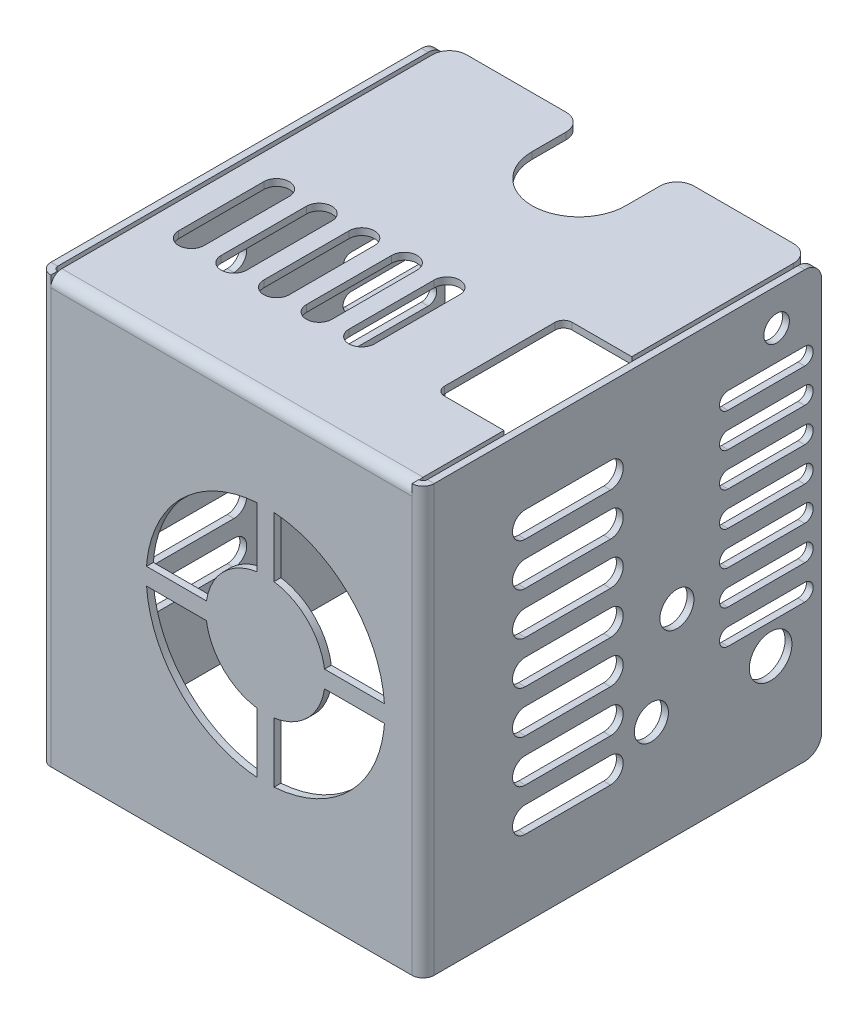
from build123d import *

# Parameters (mm, degrees)
SKETCH_1_W                       = 45
SKETCH_1_H                       = 50
SM_BASE_FLANGE_1_DEPTH           = 0.8
SM_EDGE_FLANGE_3_STRIP_W         = 4.2
SM_EDGE_FLANGE_3_STRIP_H         = 0.8
SM_EDGE_FLANGE_3_STRIP_CUT_DEPTH = 50
SM_EDGE_FLANGE_3_DEPTH           = 50
SM_EDGE_FLANGE_3_PROFILE_R       = 1.5
SM_EDGE_FLANGE_3_FLAT_DEPTH      = 0.8
SM_EDGE_FLANGE_5_STRIP_W         = 4.2
SM_EDGE_FLANGE_5_STRIP_H         = 0.8
SM_EDGE_FLANGE_5_STRIP_CUT_DEPTH = 50
SM_EDGE_FLANGE_5_DEPTH           = 50
SM_EDGE_FLANGE_5_PROFILE_R       = 2.5
SM_EDGE_FLANGE_5_PROFILE_R_2     = 1.5
SM_EDGE_FLANGE_5_FLAT_DEPTH      = 0.8
SM_EDGE_FLANGE_1_STRIP_W         = 4.2
SM_EDGE_FLANGE_1_STRIP_H         = 0.8
SM_EDGE_FLANGE_1_STRIP_CUT_DEPTH = 42.4
SM_EDGE_FLANGE_1_DEPTH           = 42.4
SM_EDGE_FLANGE_1_FLAT_DEPTH      = 0.8
SKETCH_30_R                      = 2.1
EXTRUDE_3_DEPTH                  = 8.2
HOLE_WIZARD_M2_1_D               = 1.6
HOLE_WIZARD_M2_1_DEPTH           = 6
HOLE_WIZARD_M2_1_TIP             = 0.480688495
CUT_EXTRUDE_2_REACH              = 71.572
MACRO_START                      = -0.8
MACRO_FEATURE_1_DEPTH            = 0.8
CUT_EXTRUDE_3_REACH              = 74.087
SKETCH_35_W                      = 8
SKETCH_35_H                      = 15
FILLET_1_R                       = 1
CUT_EXTRUDE_4_REACH              = 74.087
CUT_EXTRUDE_5_REACH              = 71.572
SKETCH_37_R                      = 1.5
CUT_EXTRUDE_6_REACH              = 71.572
SKETCH_38_R                      = 2


# Read off the part's stored shape, not the designer's step: 通风口1
# Sheet-metal steps are written as plain solids
with BuildPart() as part:
    # Sketch 1 → 基体-法兰1 (new body)
    with BuildSketch(Plane.XY):
        Rectangle(SKETCH_1_W, SKETCH_1_H)
    extrude(amount=-SM_BASE_FLANGE_1_DEPTH)

    # 边线-法兰3 strip (across the edge) → 边线-法兰3 strip cut (cut)
    with BuildSketch(Plane(origin=(-22.5, -25, -0.8), x_dir=(1, 0, 0), z_dir=(0, 1, 0))):
        with Locations((-0.8, -0.4)):
            Rectangle(SM_EDGE_FLANGE_3_STRIP_W, SM_EDGE_FLANGE_3_STRIP_H)
    extrude(amount=SM_EDGE_FLANGE_3_STRIP_CUT_DEPTH, mode=Mode.SUBTRACT)

    # 边线-法兰3 bend section (across the edge) → 边线-法兰3 (add)
    with BuildSketch(Plane(origin=(-22.5, -25, -0.8), x_dir=(1, 0, 0), z_dir=(0, 1, 0))):
        with BuildLine():
            Line((0, 0.5), (0.8, 0.5))
            ThreePointArc((0.8, 0.5), (0.946446609, 0.146446609), (1.3, 0))
            Line((1.3, 0), (1.3, -0.8))
            ThreePointArc((1.3, -0.8), (0.380761184, -0.419238816), (0, 0.5))
        make_face()
    extrude(amount=SM_EDGE_FLANGE_3_DEPTH)

    # 边线-法兰3 profile (on flange) → 边线-法兰3 flat (add)
    with BuildSketch(Plane(origin=(-22.5, 0, -0.8), x_dir=(0, -1, 0), z_dir=(1, 0, 0))):
        with BuildLine():
            Line((-25, 0.5), (25, 0.5))
            Line((25, 0.5), (25, 44))
            ThreePointArc((25, 44), (24.414213562, 45.414213562), (23, 46))
            Line((23, 46), (-23, 46))
            ThreePointArc((-23, 46), (-24.414213562, 45.414213562), (-25, 44))
            Line((-25, 44), (-25, 0.5))
        make_face()
        with Locations((12.3, 40.7)):
            Circle(SM_EDGE_FLANGE_3_PROFILE_R, mode=Mode.SUBTRACT)
        with Locations((-20.7, 40.7)):
            Circle(SM_EDGE_FLANGE_3_PROFILE_R, mode=Mode.SUBTRACT)
    extrude(amount=SM_EDGE_FLANGE_3_FLAT_DEPTH)

    # 边线-法兰5 strip (across the edge) → 边线-法兰5 strip cut (cut)
    with BuildSketch(Plane(origin=(22.5, 25, -0.8), x_dir=(-1, 0, 0), z_dir=(0, -1, 0))):
        with Locations((-0.8, -0.4)):
            Rectangle(SM_EDGE_FLANGE_5_STRIP_W, SM_EDGE_FLANGE_5_STRIP_H)
    extrude(amount=SM_EDGE_FLANGE_5_STRIP_CUT_DEPTH, mode=Mode.SUBTRACT)

    # 边线-法兰5 bend section (across the edge) → 边线-法兰5 (add)
    with BuildSketch(Plane(origin=(22.5, 25, -0.8), x_dir=(-1, 0, 0), z_dir=(0, -1, 0))):
        with BuildLine():
            Line((0, 0.5), (0.8, 0.5))
            ThreePointArc((0.8, 0.5), (0.946446609, 0.146446609), (1.3, 0))
            Line((1.3, 0), (1.3, -0.8))
            ThreePointArc((1.3, -0.8), (0.380761184, -0.419238816), (0, 0.5))
        make_face()
    extrude(amount=SM_EDGE_FLANGE_5_DEPTH)

    # 边线-法兰5 profile (on flange) → 边线-法兰5 flat (add)
    with BuildSketch(Plane(origin=(22.5, 0, -0.8), x_dir=(0, -1, 0), z_dir=(1, 0, 0))):
        with BuildLine():
            Line((25, 0.5), (25, 44))
            ThreePointArc((25, 44), (24.414213562, 45.414213562), (23, 46))
            Line((23, 46), (-23, 46))
            ThreePointArc((-23, 46), (-24.414213562, 45.414213562), (-25, 44))
            Line((-25, 44), (-25, 0.5))
            Line((-25, 0.5), (25, 0.5))
        make_face()
        with Locations((12.3, 40)):
            Circle(SM_EDGE_FLANGE_5_PROFILE_R, mode=Mode.SUBTRACT)
        with Locations((-20.7, 40.7)):
            Circle(SM_EDGE_FLANGE_5_PROFILE_R_2, mode=Mode.SUBTRACT)
    extrude(amount=-SM_EDGE_FLANGE_5_FLAT_DEPTH)

    # 边线-法兰1 strip (across the edge) → 边线-法兰1 strip cut (cut)
    with BuildSketch(Plane(origin=(-21.2, 25, -0.8), x_dir=(0, -1, 0), z_dir=(1, 0, 0))):
        with Locations((-0.8, -0.4)):
            Rectangle(SM_EDGE_FLANGE_1_STRIP_W, SM_EDGE_FLANGE_1_STRIP_H)
    extrude(amount=SM_EDGE_FLANGE_1_STRIP_CUT_DEPTH, mode=Mode.SUBTRACT)

    # 边线-法兰1 bend section (across the edge) → 边线-法兰1 (add)
    with BuildSketch(Plane(origin=(-21.2, 25, -0.8), x_dir=(0, -1, 0), z_dir=(1, 0, 0))):
        with BuildLine():
            Line((0, 0.5), (0.8, 0.5))
            ThreePointArc((0.8, 0.5), (0.946446609, 0.146446609), (1.3, 0))
            Line((1.3, 0), (1.3, -0.8))
            ThreePointArc((1.3, -0.8), (0.380761184, -0.419238816), (0, 0.5))
        make_face()
    extrude(amount=SM_EDGE_FLANGE_1_DEPTH)

    # 边线-法兰1 profile (on flange) → 边线-法兰1 flat (add)
    with BuildSketch(Plane(origin=(0, 25, -0.8), x_dir=(1, 0, 0), z_dir=(0, 1, 0))):
        with BuildLine():
            ThreePointArc((21.2, 44), (20.614213562, 45.414213562), (19.2, 46))
            Line((19.2, 46), (7.5, 46))
            ThreePointArc((7.5, 46), (6.085786438, 45.414213562), (5.5, 44))
            Line((5.5, 44), (5.5, 40))
            ThreePointArc((5.5, 40), (0, 34.5), (-5.5, 40))
            Line((-5.5, 40), (-5.5, 44))
            ThreePointArc((-5.5, 44), (-6.085786438, 45.414213562), (-7.5, 46))
            Line((-7.5, 46), (-19.2, 46))
            ThreePointArc((-19.2, 46), (-20.614213562, 45.414213562), (-21.2, 44))
            Line((-21.2, 44), (-21.2, 0.5))
            Line((-21.2, 0.5), (21.2, 0.5))
            Line((21.2, 0.5), (21.2, 44))
        make_face()
    extrude(amount=-SM_EDGE_FLANGE_1_FLAT_DEPTH)

    # 草图30 → 凸台-拉伸3 (add)
    with BuildSketch(Plane(origin=(0, 0, -0.8), x_dir=(-1, 0, 0), z_dir=(0, 0, -1))):
        with Locations(Location((-17.5, 17.5, 0), (0, 0, 180))):
            Circle(SKETCH_30_R)
        with Locations(Location((17.5, 17.5, 0), (0, 0, 180))):
            Circle(SKETCH_30_R)
        with Locations(Location((17.5, -17.5, 0), (0, 0, 180))):
            Circle(SKETCH_30_R)
        with Locations(Location((-17.5, -17.5, 0), (0, 0, 180))):
            Circle(SKETCH_30_R)
    extrude(amount=EXTRUDE_3_DEPTH)

    # M2 螺纹孔1
    with Locations(Plane(origin=(0, 0, -9), x_dir=(-1, 0, 0), z_dir=(0, 0, -1))):
        with Locations((-17.5, 17.5), (-17.5, -17.5), (17.5, -17.5), (17.5, 17.5)):
            Hole(HOLE_WIZARD_M2_1_D / 2, depth=HOLE_WIZARD_M2_1_DEPTH)
            with Locations((0, 0, -(HOLE_WIZARD_M2_1_DEPTH + HOLE_WIZARD_M2_1_TIP / 2))):  # 118° drill point
                Cone(0, HOLE_WIZARD_M2_1_D / 2, HOLE_WIZARD_M2_1_TIP, mode=Mode.SUBTRACT)

    # 草图33 → 切除-拉伸2 (cut, up to next)
    with BuildSketch(Plane.ZY.offset(22.5), mode=Mode.PRIVATE) as cut_extrude_2_sk1:
        with BuildLine():
            Line((-22, 17), (-12, 17))
            ThreePointArc((-12, 17), (-10.5, 15.5), (-12, 14))
            Line((-12, 14), (-22, 14))
            ThreePointArc((-22, 14), (-23.5, 15.5), (-22, 17))
        make_face()
    cut_extrude_2_tool1 = extrude(cut_extrude_2_sk1.sketch, amount=-CUT_EXTRUDE_2_REACH, mode=Mode.PRIVATE) & part.part
    # 草图33 → 切除-拉伸2 (cut, up to next)
    with BuildSketch(Plane.ZY.offset(22.5), mode=Mode.PRIVATE) as cut_extrude_2_sk2:
        with BuildLine():
            Line((-22, 12), (-12, 12))
            ThreePointArc((-12, 12), (-10.5, 10.5), (-12, 9))
            Line((-12, 9), (-22, 9))
            ThreePointArc((-22, 9), (-23.5, 10.5), (-22, 12))
        make_face()
    cut_extrude_2_tool2 = extrude(cut_extrude_2_sk2.sketch, amount=-CUT_EXTRUDE_2_REACH, mode=Mode.PRIVATE) & part.part
    # 草图33 → 切除-拉伸2 (cut, up to next)
    with BuildSketch(Plane.ZY.offset(22.5), mode=Mode.PRIVATE) as cut_extrude_2_sk3:
        with BuildLine():
            Line((-22, 7), (-12, 7))
            ThreePointArc((-12, 7), (-10.5, 5.5), (-12, 4))
            Line((-12, 4), (-22, 4))
            ThreePointArc((-22, 4), (-23.5, 5.5), (-22, 7))
        make_face()
    cut_extrude_2_tool3 = extrude(cut_extrude_2_sk3.sketch, amount=-CUT_EXTRUDE_2_REACH, mode=Mode.PRIVATE) & part.part
    # 草图33 → 切除-拉伸2 (cut, up to next)
    with BuildSketch(Plane.ZY.offset(22.5), mode=Mode.PRIVATE) as cut_extrude_2_sk4:
        with BuildLine():
            Line((-22, 2), (-12, 2))
            ThreePointArc((-12, 2), (-10.5, 0.5), (-12, -1))
            Line((-12, -1), (-22, -1))
            ThreePointArc((-22, -1), (-23.5, 0.5), (-22, 2))
        make_face()
    cut_extrude_2_tool4 = extrude(cut_extrude_2_sk4.sketch, amount=-CUT_EXTRUDE_2_REACH, mode=Mode.PRIVATE) & part.part
    # 草图33 → 切除-拉伸2 (cut, up to next)
    with BuildSketch(Plane.ZY.offset(22.5), mode=Mode.PRIVATE) as cut_extrude_2_sk5:
        with BuildLine():
            Line((-22, -3), (-12, -3))
            ThreePointArc((-12, -3), (-10.5, -4.5), (-12, -6))
            Line((-12, -6), (-22, -6))
            ThreePointArc((-22, -6), (-23.5, -4.5), (-22, -3))
        make_face()
    cut_extrude_2_tool5 = extrude(cut_extrude_2_sk5.sketch, amount=-CUT_EXTRUDE_2_REACH, mode=Mode.PRIVATE) & part.part
    # 草图33 → 切除-拉伸2 (cut, up to next)
    with BuildSketch(Plane.ZY.offset(22.5), mode=Mode.PRIVATE) as cut_extrude_2_sk6:
        with BuildLine():
            Line((-22, -8), (-12, -8))
            ThreePointArc((-12, -8), (-10.5, -9.5), (-12, -11))
            Line((-12, -11), (-22, -11))
            ThreePointArc((-22, -11), (-23.5, -9.5), (-22, -8))
        make_face()
    cut_extrude_2_tool6 = extrude(cut_extrude_2_sk6.sketch, amount=-CUT_EXTRUDE_2_REACH, mode=Mode.PRIVATE) & part.part
    # 草图33 → 切除-拉伸2 (cut, up to next)
    with BuildSketch(Plane.ZY.offset(22.5), mode=Mode.PRIVATE) as cut_extrude_2_sk7:
        with BuildLine():
            Line((-22, -13), (-12, -13))
            ThreePointArc((-12, -13), (-10.5, -14.5), (-12, -16))
            Line((-12, -16), (-22, -16))
            ThreePointArc((-22, -16), (-23.5, -14.5), (-22, -13))
        make_face()
    cut_extrude_2_tool7 = extrude(cut_extrude_2_sk7.sketch, amount=-CUT_EXTRUDE_2_REACH, mode=Mode.PRIVATE) & part.part
    # 草图33 → 切除-拉伸2 (cut, up to next)
    with BuildSketch(Plane.ZY.offset(22.5), mode=Mode.PRIVATE) as cut_extrude_2_sk8:
        with BuildLine():
            Line((-44.8, 17.2), (-35.8, 17.2))
            ThreePointArc((-35.8, 17.2), (-34.8, 16.2), (-35.8, 15.2))
            Line((-35.8, 15.2), (-44.8, 15.2))
            ThreePointArc((-44.8, 15.2), (-45.8, 16.2), (-44.8, 17.2))
        make_face()
    cut_extrude_2_tool8 = extrude(cut_extrude_2_sk8.sketch, amount=-CUT_EXTRUDE_2_REACH, mode=Mode.PRIVATE) & part.part
    # 草图33 → 切除-拉伸2 (cut, up to next)
    with BuildSketch(Plane.ZY.offset(22.5), mode=Mode.PRIVATE) as cut_extrude_2_sk9:
        with BuildLine():
            Line((-44.8, 13.2), (-35.8, 13.2))
            ThreePointArc((-35.8, 13.2), (-34.8, 12.2), (-35.8, 11.2))
            Line((-35.8, 11.2), (-44.8, 11.2))
            ThreePointArc((-44.8, 11.2), (-45.8, 12.2), (-44.8, 13.2))
        make_face()
    cut_extrude_2_tool9 = extrude(cut_extrude_2_sk9.sketch, amount=-CUT_EXTRUDE_2_REACH, mode=Mode.PRIVATE) & part.part
    # 草图33 → 切除-拉伸2 (cut, up to next)
    with BuildSketch(Plane.ZY.offset(22.5), mode=Mode.PRIVATE) as cut_extrude_2_sk10:
        with BuildLine():
            Line((-44.8, 9.2), (-35.8, 9.2))
            ThreePointArc((-35.8, 9.2), (-34.8, 8.2), (-35.8, 7.2))
            Line((-35.8, 7.2), (-44.8, 7.2))
            ThreePointArc((-44.8, 7.2), (-45.8, 8.2), (-44.8, 9.2))
        make_face()
    cut_extrude_2_tool10 = extrude(cut_extrude_2_sk10.sketch, amount=-CUT_EXTRUDE_2_REACH, mode=Mode.PRIVATE) & part.part
    # 草图33 → 切除-拉伸2 (cut, up to next)
    with BuildSketch(Plane.ZY.offset(22.5), mode=Mode.PRIVATE) as cut_extrude_2_sk11:
        with BuildLine():
            Line((-44.8, 5.2), (-35.8, 5.2))
            ThreePointArc((-35.8, 5.2), (-34.8, 4.2), (-35.8, 3.2))
            Line((-35.8, 3.2), (-44.8, 3.2))
            ThreePointArc((-44.8, 3.2), (-45.8, 4.2), (-44.8, 5.2))
        make_face()
    cut_extrude_2_tool11 = extrude(cut_extrude_2_sk11.sketch, amount=-CUT_EXTRUDE_2_REACH, mode=Mode.PRIVATE) & part.part
    # 草图33 → 切除-拉伸2 (cut, up to next)
    with BuildSketch(Plane.ZY.offset(22.5), mode=Mode.PRIVATE) as cut_extrude_2_sk12:
        with BuildLine():
            Line((-44.8, 1.2), (-35.8, 1.2))
            ThreePointArc((-35.8, 1.2), (-34.8, 0.2), (-35.8, -0.8))
            Line((-35.8, -0.8), (-44.8, -0.8))
            ThreePointArc((-44.8, -0.8), (-45.8, 0.2), (-44.8, 1.2))
        make_face()
    cut_extrude_2_tool12 = extrude(cut_extrude_2_sk12.sketch, amount=-CUT_EXTRUDE_2_REACH, mode=Mode.PRIVATE) & part.part
    # 草图33 → 切除-拉伸2 (cut, up to next)
    with BuildSketch(Plane.ZY.offset(22.5), mode=Mode.PRIVATE) as cut_extrude_2_sk13:
        with BuildLine():
            Line((-44.8, -2.8), (-35.8, -2.8))
            ThreePointArc((-35.8, -2.8), (-34.8, -3.8), (-35.8, -4.8))
            Line((-35.8, -4.8), (-44.8, -4.8))
            ThreePointArc((-44.8, -4.8), (-45.8, -3.8), (-44.8, -2.8))
        make_face()
    cut_extrude_2_tool13 = extrude(cut_extrude_2_sk13.sketch, amount=-CUT_EXTRUDE_2_REACH, mode=Mode.PRIVATE) & part.part
    # 草图33 → 切除-拉伸2 (cut, up to next)
    with BuildSketch(Plane.ZY.offset(22.5), mode=Mode.PRIVATE) as cut_extrude_2_sk14:
        with BuildLine():
            Line((-44.8, -6.8), (-35.8, -6.8))
            ThreePointArc((-35.8, -6.8), (-34.8, -7.8), (-35.8, -8.8))
            Line((-35.8, -8.8), (-44.8, -8.8))
            ThreePointArc((-44.8, -8.8), (-45.8, -7.8), (-44.8, -6.8))
        make_face()
    cut_extrude_2_tool14 = extrude(cut_extrude_2_sk14.sketch, amount=-CUT_EXTRUDE_2_REACH, mode=Mode.PRIVATE) & part.part
    cut_extrude_2_1 = cut_extrude_2_tool1.solids().sort_by_distance((-22.5, 15.5, -17))[0]
    add(cut_extrude_2_1, mode=Mode.SUBTRACT)
    cut_extrude_2_2 = cut_extrude_2_tool2.solids().sort_by_distance((-22.5, 10.5, -17))[0]
    add(cut_extrude_2_2, mode=Mode.SUBTRACT)
    cut_extrude_2_3 = cut_extrude_2_tool3.solids().sort_by_distance((-22.5, 5.5, -17))[0]
    add(cut_extrude_2_3, mode=Mode.SUBTRACT)
    cut_extrude_2_4 = cut_extrude_2_tool4.solids().sort_by_distance((-22.5, 0.5, -17))[0]
    add(cut_extrude_2_4, mode=Mode.SUBTRACT)
    cut_extrude_2_5 = cut_extrude_2_tool5.solids().sort_by_distance((-22.5, -4.5, -17))[0]
    add(cut_extrude_2_5, mode=Mode.SUBTRACT)
    cut_extrude_2_6 = cut_extrude_2_tool6.solids().sort_by_distance((-22.5, -9.5, -17))[0]
    add(cut_extrude_2_6, mode=Mode.SUBTRACT)
    cut_extrude_2_7 = cut_extrude_2_tool7.solids().sort_by_distance((-22.5, -14.5, -17))[0]
    add(cut_extrude_2_7, mode=Mode.SUBTRACT)
    cut_extrude_2_8 = cut_extrude_2_tool8.solids().sort_by_distance((-22.5, 16.2, -40.3))[0]
    add(cut_extrude_2_8, mode=Mode.SUBTRACT)
    cut_extrude_2_9 = cut_extrude_2_tool9.solids().sort_by_distance((-22.5, 12.2, -40.3))[0]
    add(cut_extrude_2_9, mode=Mode.SUBTRACT)
    cut_extrude_2_10 = cut_extrude_2_tool10.solids().sort_by_distance((-22.5, 8.2, -40.3))[0]
    add(cut_extrude_2_10, mode=Mode.SUBTRACT)
    cut_extrude_2_11 = cut_extrude_2_tool11.solids().sort_by_distance((-22.5, 4.2, -40.3))[0]
    add(cut_extrude_2_11, mode=Mode.SUBTRACT)
    cut_extrude_2_12 = cut_extrude_2_tool12.solids().sort_by_distance((-22.5, 0.2, -40.3))[0]
    add(cut_extrude_2_12, mode=Mode.SUBTRACT)
    cut_extrude_2_13 = cut_extrude_2_tool13.solids().sort_by_distance((-22.5, -3.8, -40.3))[0]
    add(cut_extrude_2_13, mode=Mode.SUBTRACT)
    cut_extrude_2_14 = cut_extrude_2_tool14.solids().sort_by_distance((-22.5, -7.8, -40.3))[0]
    add(cut_extrude_2_14, mode=Mode.SUBTRACT)
    cut_extrude_2 = cut_extrude_2_1 + cut_extrude_2_2 + cut_extrude_2_3 + cut_extrude_2_4 + cut_extrude_2_5 + cut_extrude_2_6 + cut_extrude_2_7 + cut_extrude_2_8 + cut_extrude_2_9 + cut_extrude_2_10 + cut_extrude_2_11 + cut_extrude_2_12 + cut_extrude_2_13 + cut_extrude_2_14  # 切除-拉伸2 as one shape, for the pattern or mirror that repeats it

    # 镜向1: 切除-拉伸2 across plane
    add(cut_extrude_2.mirror(Plane(origin=(0, 0, 0), x_dir=(0, 0, 1), z_dir=(1, 0, 0))), mode=Mode.SUBTRACT)

    # Macro Feature 1 outline → Macro Feature 1 (cut)
    with BuildSketch(Plane.XY.offset(MACRO_START)):
        with BuildLine():
            Line((-2.928187254, -0.999991766), (-9.964193742, -0.999989748))
            add(Edge.make_bspline(
                [(-9.964193742, -0.999989748), (-9.922550496, -1.581182669), (-9.722195201, -3.069663372), (-9.017690546, -5.392103975), (-7.715611972, -7.82812165), (-5.963309, -9.963309), (-3.82812165, -11.715611972), (-1.392103975, -13.017690546), (0.930336395, -13.722195131), (2.418816849, -13.922550431), (3.000009526, -13.96419369)],
                knots=[0.511377848, 0.511377848, 0.511377848, 0.511377848, 0.53125, 0.5625, 0.59375, 0.625, 0.65625, 0.6875, 0.71875, 0.738622143, 0.738622143, 0.738622143, 0.738622143], degree=3))
            Line((3.000009526, -13.96419369), (3.000005517, -6.928186862))
            add(Edge.make_bspline(
                [(-2.928187254, -0.999991766), (-2.910526768, -1.122397962), (-2.812191292, -1.69605418), (-2.508845273, -2.696051988), (-1.857805986, -3.914060825), (-0.9816545, -4.9816545), (0.085939175, -5.857805986), (1.303948012, -6.508845273), (2.30394494, -6.812191025), (2.877600234, -6.910526458), (3.000005517, -6.928186862)],
                knots=[0.522814303, 0.522814303, 0.522814303, 0.522814303, 0.53125, 0.5625, 0.59375, 0.625, 0.65625, 0.6875, 0.71875, 0.727185634, 0.727185634, 0.727185634, 0.727185634], degree=3))
        make_face()
        with BuildLine():
            Line((4.999999988, -6.928186068), (4.999989743, -13.964193742))
            add(Edge.make_bspline(
                [(4.999989743, -13.964193742), (5.581182665, -13.922550496), (7.06966337, -13.722195202), (9.392103975, -13.017690546), (11.82812165, -11.715611972), (13.963309, -9.963309), (15.715611972, -7.82812165), (17.017690546, -5.392103975), (17.722195213, -3.069663332), (17.922550507, -1.581182587), (17.96419375, -0.999989625)],
                knots=[0.761377848, 0.761377848, 0.761377848, 0.761377848, 0.78125, 0.8125, 0.84375, 0.875, 0.90625, 0.9375, 0.96875, 0.988622153, 0.988622153, 0.988622153, 0.988622153], degree=3))
            Line((17.96419375, -0.999989625), (10.928186922, -0.999994072))
            add(Edge.make_bspline(
                [(4.999999988, -6.928186068), (5.122403422, -6.910525832), (5.696056843, -6.812190484), (6.696051988, -6.508845273), (7.914060825, -5.857805986), (8.9816545, -4.9816545), (9.857805986, -3.914060825), (10.508845273, -2.696051988), (10.812191065, -1.696054927), (10.910526505, -1.122399493), (10.928186922, -0.999994072)],
                knots=[0.772814492, 0.772814492, 0.772814492, 0.772814492, 0.78125, 0.8125, 0.84375, 0.875, 0.90625, 0.9375, 0.96875, 0.977185644, 0.977185644, 0.977185644, 0.977185644], degree=3))
        make_face()
        with BuildLine():
            Line((3.000008234, 6.928187254), (3.000010257, 13.964193742))
            add(Edge.make_bspline(
                [(3.000010257, 13.964193742), (2.418817335, 13.922550496), (0.93033663, 13.722195202), (-1.392103975, 13.017690546), (-3.82812165, 11.715611972), (-5.963309, 9.963309), (-7.715611972, 7.82812165), (-9.017690546, 5.392103975), (-9.722195131, 3.069663605), (-9.922550431, 1.581183151), (-9.96419369, 0.999990474)],
                knots=[0.261377848, 0.261377848, 0.261377848, 0.261377848, 0.28125, 0.3125, 0.34375, 0.375, 0.40625, 0.4375, 0.46875, 0.488622143, 0.488622143, 0.488622143, 0.488622143], degree=3))
            Line((-9.96419369, 0.999990474), (-2.928186863, 0.999994482))
            add(Edge.make_bspline(
                [(3.000008234, 6.928187254), (2.877602038, 6.910526768), (2.30394582, 6.812191292), (1.303948012, 6.508845273), (0.085939175, 5.857805986), (-0.9816545, 4.9816545), (-1.857805986, 3.914060825), (-2.508845273, 2.696051988), (-2.812191025, 1.69605506), (-2.910526458, 1.122399766), (-2.928186863, 0.999994482)],
                knots=[0.272814303, 0.272814303, 0.272814303, 0.272814303, 0.28125, 0.3125, 0.34375, 0.375, 0.40625, 0.4375, 0.46875, 0.477185634, 0.477185634, 0.477185634, 0.477185634], degree=3))
        make_face()
        with BuildLine():
            Line((10.928187136, 0.999992588), (17.964193681, 0.999990596))
            add(Edge.make_bspline(
                [(17.964193681, 0.999990596), (17.92255042, 1.581183232), (17.722195119, 3.069663644), (17.017690546, 5.392103975), (15.715611972, 7.82812165), (13.963309, 9.963309), (11.82812165, 11.715611972), (9.392103975, 13.017690546), (7.069663603, 13.722195131), (5.581183147, 13.922550431), (4.999990469, 13.96419369)],
                knots=[0.011377858, 0.011377858, 0.011377858, 0.011377858, 0.03125, 0.0625, 0.09375, 0.125, 0.15625, 0.1875, 0.21875, 0.238622143, 0.238622143, 0.238622143, 0.238622143], degree=3))
            Line((4.999990469, 13.96419369), (4.999994482, 6.928186863))
            add(Edge.make_bspline(
                [(10.928187136, 0.999992588), (10.910526674, 1.122398508), (10.812191211, 1.696054446), (10.508845273, 2.696051988), (9.857805986, 3.914060825), (8.9816545, 4.9816545), (7.914060825, 5.857805986), (6.696051988, 6.508845273), (5.69605506, 6.812191025), (5.122399766, 6.910526458), (4.999994482, 6.928186863)],
                knots=[0.022814322, 0.022814322, 0.022814322, 0.022814322, 0.03125, 0.0625, 0.09375, 0.125, 0.15625, 0.1875, 0.21875, 0.227185634, 0.227185634, 0.227185634, 0.227185634], degree=3))
        make_face()
    extrude(amount=MACRO_FEATURE_1_DEPTH, mode=Mode.SUBTRACT)

    # 草图35 → 切除-拉伸3 (cut, up to next)
    with BuildSketch(Plane(origin=(0, 25, 0), x_dir=(1, 0, 0), z_dir=(0, 1, 0)), mode=Mode.PRIVATE) as cut_extrude_3_sk1:
        with Locations((17.2, 18.3)):
            Rectangle(SKETCH_35_W, SKETCH_35_H)
    cut_extrude_3_tool1 = extrude(cut_extrude_3_sk1.sketch, amount=-CUT_EXTRUDE_3_REACH, mode=Mode.PRIVATE) & part.part
    add(cut_extrude_3_tool1.solids().sort_by_distance((17.2, 25, -18.3))[0], mode=Mode.SUBTRACT)

    # 圆角1
    fillet_1_edges = [part.edges().sort_by_distance(p)[0] for p in [
        (13.2, 24.6, -10.8),
        (13.2, 24.6, -25.8),
    ]]
    fillet(fillet_1_edges, radius=FILLET_1_R)

    # 草图36 → 切除-拉伸4 (cut, up to next)
    with BuildSketch(Plane(origin=(0, 25, 0), x_dir=(1, 0, 0), z_dir=(0, 1, 0)), mode=Mode.PRIVATE) as cut_extrude_4_sk1:
        with BuildLine():
            Line((-15.2, 22), (-15.2, 12))
            ThreePointArc((-15.2, 12), (-16.7, 10.5), (-18.2, 12))
            Line((-18.2, 12), (-18.2, 22))
            ThreePointArc((-18.2, 22), (-16.7, 23.5), (-15.2, 22))
        make_face()
    cut_extrude_4_tool1 = extrude(cut_extrude_4_sk1.sketch, amount=-CUT_EXTRUDE_4_REACH, mode=Mode.PRIVATE) & part.part
    # 草图36 → 切除-拉伸4 (cut, up to next)
    with BuildSketch(Plane(origin=(0, 25, 0), x_dir=(1, 0, 0), z_dir=(0, 1, 0)), mode=Mode.PRIVATE) as cut_extrude_4_sk2:
        with BuildLine():
            Line((-10.2, 22), (-10.2, 12))
            ThreePointArc((-10.2, 12), (-11.7, 10.5), (-13.2, 12))
            Line((-13.2, 12), (-13.2, 22))
            ThreePointArc((-13.2, 22), (-11.7, 23.5), (-10.2, 22))
        make_face()
    cut_extrude_4_tool2 = extrude(cut_extrude_4_sk2.sketch, amount=-CUT_EXTRUDE_4_REACH, mode=Mode.PRIVATE) & part.part
    # 草图36 → 切除-拉伸4 (cut, up to next)
    with BuildSketch(Plane(origin=(0, 25, 0), x_dir=(1, 0, 0), z_dir=(0, 1, 0)), mode=Mode.PRIVATE) as cut_extrude_4_sk3:
        with BuildLine():
            Line((-5.2, 22), (-5.2, 12))
            ThreePointArc((-5.2, 12), (-6.7, 10.5), (-8.2, 12))
            Line((-8.2, 12), (-8.2, 22))
            ThreePointArc((-8.2, 22), (-6.7, 23.5), (-5.2, 22))
        make_face()
    cut_extrude_4_tool3 = extrude(cut_extrude_4_sk3.sketch, amount=-CUT_EXTRUDE_4_REACH, mode=Mode.PRIVATE) & part.part
    # 草图36 → 切除-拉伸4 (cut, up to next)
    with BuildSketch(Plane(origin=(0, 25, 0), x_dir=(1, 0, 0), z_dir=(0, 1, 0)), mode=Mode.PRIVATE) as cut_extrude_4_sk4:
        with BuildLine():
            Line((-0.2, 22), (-0.2, 12))
            ThreePointArc((-0.2, 12), (-1.7, 10.5), (-3.2, 12))
            Line((-3.2, 12), (-3.2, 22))
            ThreePointArc((-3.2, 22), (-1.7, 23.5), (-0.2, 22))
        make_face()
    cut_extrude_4_tool4 = extrude(cut_extrude_4_sk4.sketch, amount=-CUT_EXTRUDE_4_REACH, mode=Mode.PRIVATE) & part.part
    # 草图36 → 切除-拉伸4 (cut, up to next)
    with BuildSketch(Plane(origin=(0, 25, 0), x_dir=(1, 0, 0), z_dir=(0, 1, 0)), mode=Mode.PRIVATE) as cut_extrude_4_sk5:
        with BuildLine():
            Line((4.8, 22), (4.8, 12))
            ThreePointArc((4.8, 12), (3.3, 10.5), (1.8, 12))
            Line((1.8, 12), (1.8, 22))
            ThreePointArc((1.8, 22), (3.3, 23.5), (4.8, 22))
        make_face()
    cut_extrude_4_tool5 = extrude(cut_extrude_4_sk5.sketch, amount=-CUT_EXTRUDE_4_REACH, mode=Mode.PRIVATE) & part.part
    add(cut_extrude_4_tool1.solids().sort_by_distance((-16.7, 25, -17))[0], mode=Mode.SUBTRACT)
    add(cut_extrude_4_tool2.solids().sort_by_distance((-11.7, 25, -17))[0], mode=Mode.SUBTRACT)
    add(cut_extrude_4_tool3.solids().sort_by_distance((-6.7, 25, -17))[0], mode=Mode.SUBTRACT)
    add(cut_extrude_4_tool4.solids().sort_by_distance((-1.7, 25, -17))[0], mode=Mode.SUBTRACT)
    add(cut_extrude_4_tool5.solids().sort_by_distance((3.3, 25, -17))[0], mode=Mode.SUBTRACT)

    # 草图37 → 切除-拉伸5 (cut, up to next)
    with BuildSketch(Plane.ZY.offset(22.5), mode=Mode.PRIVATE) as cut_extrude_5_sk1:
        with Locations((-26.8, -12)):
            Circle(SKETCH_37_R)
    cut_extrude_5_tool1 = extrude(cut_extrude_5_sk1.sketch, amount=-CUT_EXTRUDE_5_REACH, mode=Mode.PRIVATE) & part.part
    # 草图37 → 切除-拉伸5 (cut, up to next)
    with BuildSketch(Plane.ZY.offset(22.5), mode=Mode.PRIVATE) as cut_extrude_5_sk2:
        with Locations((-29.8, -2)):
            Circle(SKETCH_37_R)
    cut_extrude_5_tool2 = extrude(cut_extrude_5_sk2.sketch, amount=-CUT_EXTRUDE_5_REACH, mode=Mode.PRIVATE) & part.part
    add(cut_extrude_5_tool1.solids().sort_by_distance((-22.5, -12, -26.8))[0], mode=Mode.SUBTRACT)
    add(cut_extrude_5_tool2.solids().sort_by_distance((-22.5, -2, -29.8))[0], mode=Mode.SUBTRACT)

    # 草图38 → 切除-拉伸6 (cut, up to next)
    with BuildSketch(Plane(origin=(22.5, 0, 0), x_dir=(0, 0, -1), z_dir=(1, 0, 0)), mode=Mode.PRIVATE) as cut_extrude_6_sk1:
        with Locations((29.8, -2)):
            Circle(SKETCH_38_R)
    cut_extrude_6_tool1 = extrude(cut_extrude_6_sk1.sketch, amount=-CUT_EXTRUDE_6_REACH, mode=Mode.PRIVATE) & part.part
    # 草图38 → 切除-拉伸6 (cut, up to next)
    with BuildSketch(Plane(origin=(22.5, 0, 0), x_dir=(0, 0, -1), z_dir=(1, 0, 0)), mode=Mode.PRIVATE) as cut_extrude_6_sk2:
        with Locations((26.8, -12)):
            Circle(SKETCH_38_R)
    cut_extrude_6_tool2 = extrude(cut_extrude_6_sk2.sketch, amount=-CUT_EXTRUDE_6_REACH, mode=Mode.PRIVATE) & part.part
    add(cut_extrude_6_tool1.solids().sort_by_distance((22.5, -2, -29.8))[0], mode=Mode.SUBTRACT)
    add(cut_extrude_6_tool2.solids().sort_by_distance((22.5, -12, -26.8))[0], mode=Mode.SUBTRACT)


solid = part.part
